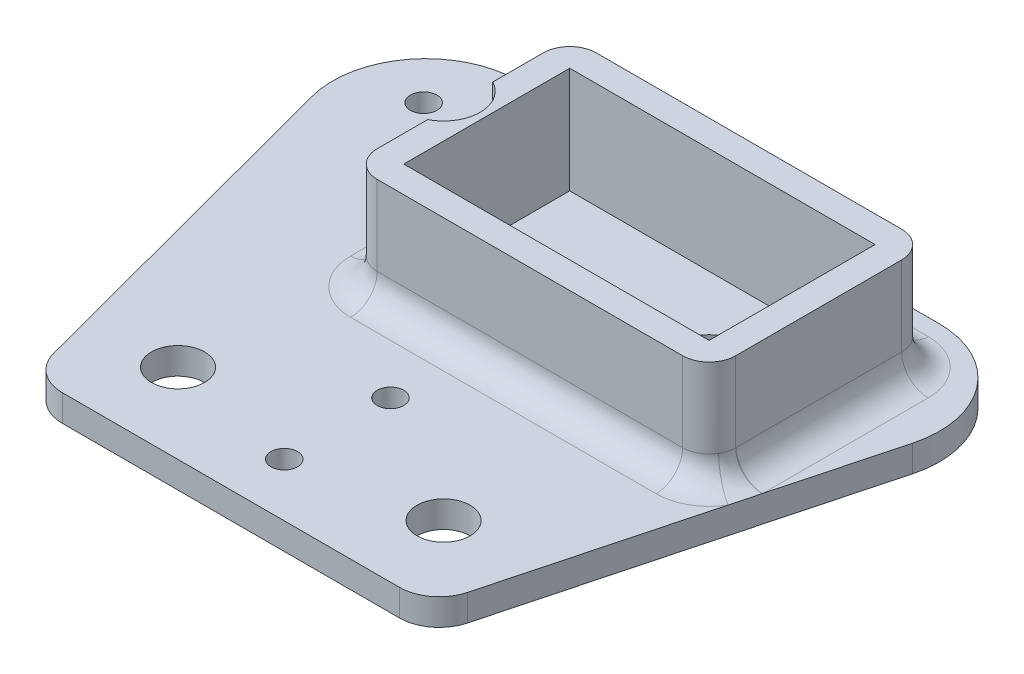
from build123d import *

# Parameters (mm, degrees)
SKETCH1_R               = 3
SKETCH1_R_2             = 2
BOSS_EXTRUDE1_DEPTH     = 2
FILLET1_R               = 7
SKETCH3_W               = 27
SKETCH3_H               = 16.5
SKETCH3_W_2             = 23
SKETCH3_H_2             = 12.5
BOSS_EXTRUDE2_DEPTH     = 8
FILLET2_R               = 2
FILLET3_R               = 2
CUT_EXTRUDE2_DEPTH      = 45.635758586
CUT_EXTRUDE2_DEPTH_BACK = 45.635758586
SKETCH4_R               = 2
SKETCH5_R               = 2.75
CUT_EXTRUDE3_DEPTH      = 45.635758586
FILLET4_R               = 3
SKETCH2_R               = 1
CUT_EXTRUDE4_DEPTH      = 10


with BuildPart() as part:
    # Sketch1 → Boss-Extrude1 (new body)
    with BuildSketch(Plane(origin=(0, 0, 0), x_dir=(1, 0, 0), z_dir=(0, 1, 0))):
        Polygon((15, 0), (24.948794511, 37.5), (-24.948794511, 37.5), (-15, 0), (-14.994980965, -0.018918254), (14.994980965, -0.018918254), align=None)
        with Locations((10, 26)):
            Circle(SKETCH1_R, mode=Mode.SUBTRACT)
        with Locations((10, 6)):
            Circle(SKETCH1_R_2, mode=Mode.SUBTRACT)
        with Locations((-10, 6)):
            Circle(SKETCH1_R_2, mode=Mode.SUBTRACT)
    extrude(amount=BOSS_EXTRUDE1_DEPTH)

    # Fillet1
    fillet1_edges = [part.edges().sort_by_distance(p)[0] for p in [
        (24.948794511, 1, -37.5),
        (-24.948794511, 1, -37.5),
    ]]
    fillet(fillet1_edges, radius=FILLET1_R)

    # Sketch3 → Boss-Extrude2 (add)
    with BuildSketch(Plane(origin=(0, 2, 0), x_dir=(1, 0, 0), z_dir=(0, 1, 0))):
        with Locations((4.75, 26)):
            Rectangle(SKETCH3_W, SKETCH3_H)
        with Locations((4.75, 26)):
            Rectangle(SKETCH3_W_2, SKETCH3_H_2, mode=Mode.SUBTRACT)
    extrude(amount=BOSS_EXTRUDE2_DEPTH)

    # Fillet2
    fillet2_edges = [part.edges().sort_by_distance(p)[0] for p in [
        (-8.75, 6, -17.75),
        (18.25, 6, -17.75),
        (18.25, 6, -34.25),
        (-8.75, 6, -34.25),
    ]]
    fillet(fillet2_edges, radius=FILLET2_R)

    # Fillet3
    fillet3_edges = [part.edges().sort_by_distance(p)[0] for p in [
        (-8.164213562, 2, -33.664213562),
        (4.75, 2, -34.25),
        (17.664213562, 2, -33.664213562),
        (18.25, 2, -26),
        (17.664213562, 2, -18.335786438),
        (4.75, 2, -17.75),
        (-8.164213562, 2, -18.335786438),
        (-8.75, 2, -26),
    ]]
    fillet(fillet3_edges, radius=FILLET3_R)

    # Sketch4 → Cut-Extrude2 (cut, two sides: drawn at the far end of the back side and taken through both)
    with BuildSketch(Plane(origin=(0, 2, 0), x_dir=(1, 0, 0), z_dir=(0, 1, 0)).offset(-CUT_EXTRUDE2_DEPTH_BACK)):
        with Locations((-10, 26)):
            Circle(SKETCH4_R)
    extrude(amount=CUT_EXTRUDE2_DEPTH + CUT_EXTRUDE2_DEPTH_BACK, mode=Mode.SUBTRACT)

    # Sketch5 → Cut-Extrude3 (cut, through all)
    with BuildSketch(Plane(origin=(0, 2, 0), x_dir=(1, 0, 0), z_dir=(0, 1, 0))):
        with Locations((-10, 26)):
            Circle(SKETCH5_R)
    extrude(amount=CUT_EXTRUDE3_DEPTH, mode=Mode.SUBTRACT)

    # Fillet4
    fillet4_edges = [part.edges().sort_by_distance(p)[0] for p in [
        (14.994980965, 1, 0.018918254),
        (-14.994980965, 1, 0.018918254),
    ]]
    fillet(fillet4_edges, radius=FILLET4_R)

    # Sketch2 → Cut-Extrude4 (cut)
    with BuildSketch(Plane(origin=(0, 2, 0), x_dir=(1, 0, 0), z_dir=(0, 1, 0))):
        with Locations((0, 34.5)):
            Circle(SKETCH2_R)
        with Locations((18, 32.5)):
            Circle(SKETCH2_R)
        with Locations((0, 4)):
            Circle(SKETCH2_R)
        with Locations((0, 12)):
            Circle(SKETCH2_R)
        with Locations((-18, 32.5)):
            Circle(SKETCH2_R)
    extrude(amount=-CUT_EXTRUDE4_DEPTH, mode=Mode.SUBTRACT)


solid = part.part
